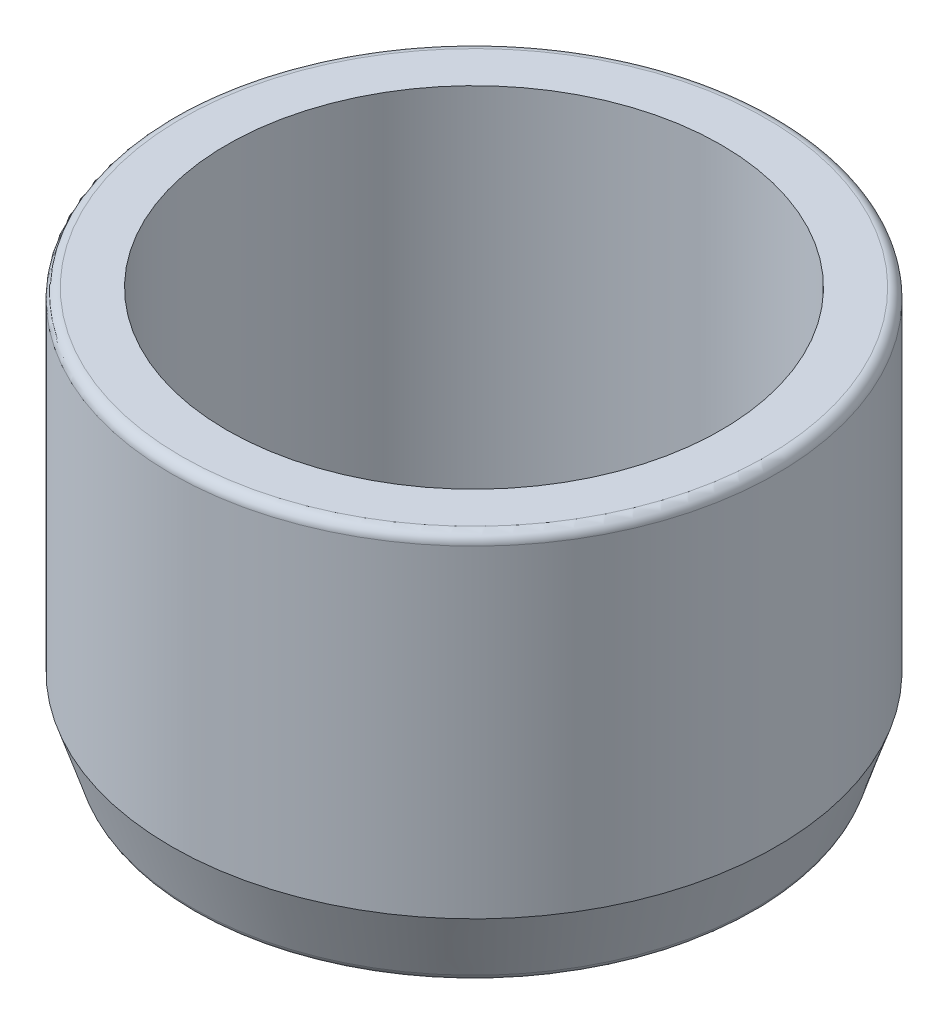
from build123d import *

# Parameters (mm, degrees)
SKETCH1_R           = 30
SKETCH1_R_2         = 24.5
BOSS_EXTRUDE1_DEPTH = 20
CHAMFER2_SIZE       = 2.31
CHAMFER2_SIZE2      = 7
FILLET1_R           = 1


with BuildPart() as part:
    # Sketch1 → Boss-Extrude1 (new, symmetric)
    with BuildSketch(Plane(origin=(0, 0, 0), x_dir=(1, 0, 0), z_dir=(0, 1, 0))):
        Circle(SKETCH1_R)
        Circle(SKETCH1_R_2, mode=Mode.SUBTRACT)
    extrude(amount=BOSS_EXTRUDE1_DEPTH, both=True)

    # Chamfer2
    chamfer2_edges = [part.edges().sort_by_distance(p)[0] for p in [
        (-30, -20, 0),
    ]]
    chamfer2_side = [part.faces().sort_by_distance(p)[0] for p in [
        (-29.151471863, -20, 0),
    ]]
    chamfer(chamfer2_edges, length=CHAMFER2_SIZE, length2=CHAMFER2_SIZE2, reference=chamfer2_side[0])

    # Fillet1
    fillet1_edges = [part.edges().sort_by_distance(p)[0] for p in [
        (-27.69, -20, 0),
        (-30, 20, 0),
    ]]
    fillet(fillet1_edges, radius=FILLET1_R)


solid = part.part
